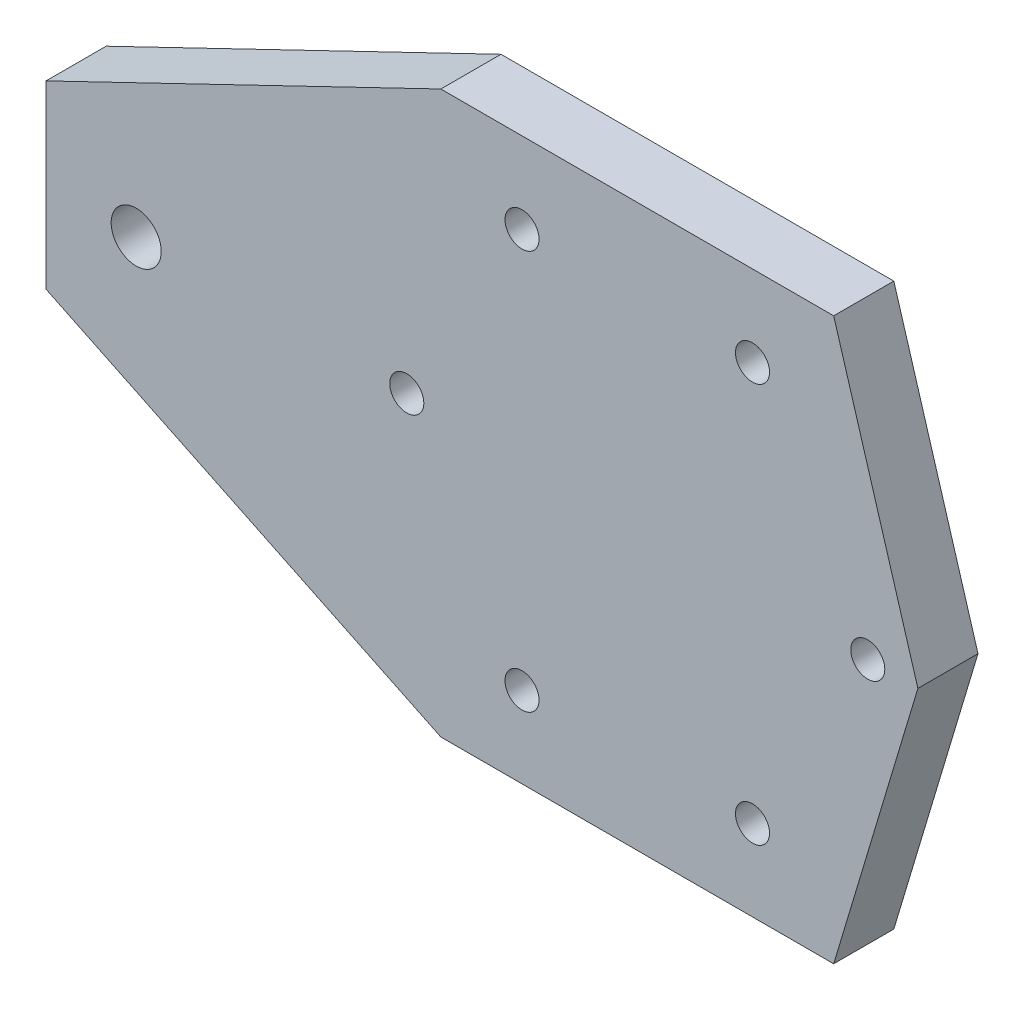
from build123d import *

# Parameters (mm, degrees)
SK_CRANK_PLATE_R   = 1.7
SK_CRANK_PLATE_R_2 = 2.5
CRANK_PLATE_DEPTH  = 6


with BuildPart() as part:
    # SK_Crank_Plate → Crank_Plate (new body)
    with BuildSketch(Plane.XY):
        Polygon((-59, -9), (-19.6, -28), (19.6, -28), (28, 0), (19.6, 28), (-19.6, 28), (-59, 9), align=None)
        with Locations((23, 0)):
            Circle(SK_CRANK_PLATE_R, mode=Mode.SUBTRACT)
        with Locations((11.5, 19.918584287)):
            Circle(SK_CRANK_PLATE_R, mode=Mode.SUBTRACT)
        with Locations((-11.5, 19.918584287)):
            Circle(SK_CRANK_PLATE_R, mode=Mode.SUBTRACT)
        with Locations((-23, 0)):
            Circle(SK_CRANK_PLATE_R, mode=Mode.SUBTRACT)
        with Locations((-11.5, -19.918584287)):
            Circle(SK_CRANK_PLATE_R, mode=Mode.SUBTRACT)
        with Locations((11.5, -19.918584287)):
            Circle(SK_CRANK_PLATE_R, mode=Mode.SUBTRACT)
        with Locations((-50, 0)):
            Circle(SK_CRANK_PLATE_R_2, mode=Mode.SUBTRACT)
    extrude(amount=CRANK_PLATE_DEPTH)


solid = part.part
